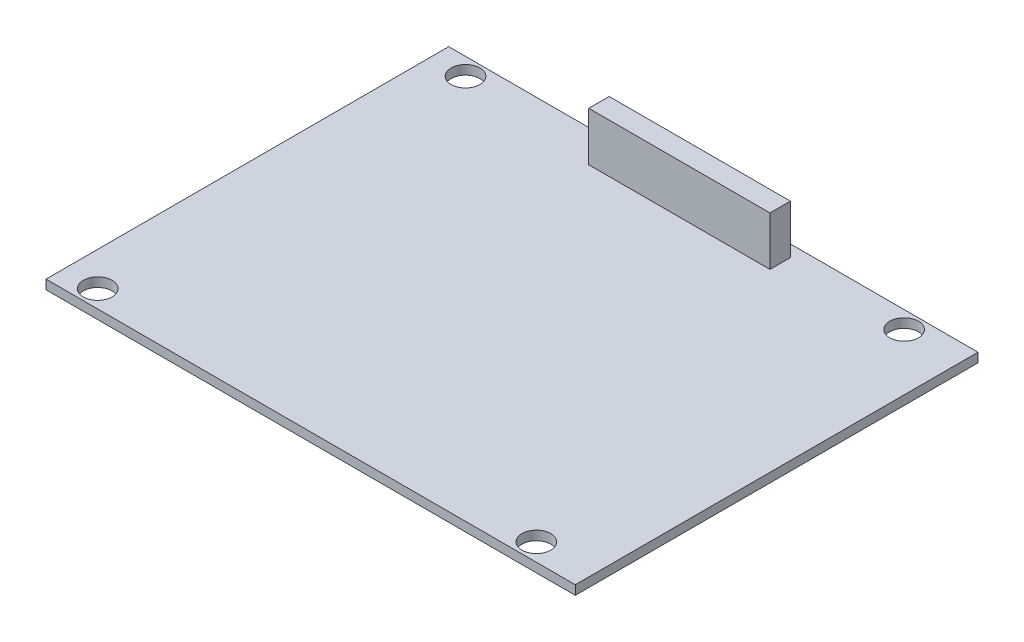
from build123d import *

# Parameters (mm, degrees)
SKETCH1_W           = 92
SKETCH1_H           = 70
SKETCH1_R           = 2.5
Y_PCB_EXTR_DEPTH    = 1.6
SKETCH2_W           = 31.5
SKETCH2_H           = 3.55
BOSS_EXTRUDE2_DEPTH = 8.5


with BuildPart() as part:
    # Sketch1 → Y+ PCB extr (new body)
    with BuildSketch(Plane(origin=(0, 0, 0), x_dir=(1, 0, 0), z_dir=(0, 1, 0))):
        with Locations((46, 35)):
            Rectangle(SKETCH1_W, SKETCH1_H)
        with Locations((5.92, 3.07)):
            Circle(SKETCH1_R, mode=Mode.SUBTRACT)
        with Locations((82.16, 3.07)):
            Circle(SKETCH1_R, mode=Mode.SUBTRACT)
        with Locations((82.16, 67)):
            Circle(SKETCH1_R, mode=Mode.SUBTRACT)
        with Locations((5.92, 67)):
            Circle(SKETCH1_R, mode=Mode.SUBTRACT)
    extrude(amount=Y_PCB_EXTR_DEPTH)

    # Sketch2 → Boss-Extrude2 (add)
    with BuildSketch(Plane(origin=(0, 1.6, 0), x_dir=(1, 0, 0), z_dir=(0, 1, 0))):
        with Locations((45.7, 66.165)):
            Rectangle(SKETCH2_W, SKETCH2_H)
    extrude(amount=BOSS_EXTRUDE2_DEPTH)


solid = part.part
